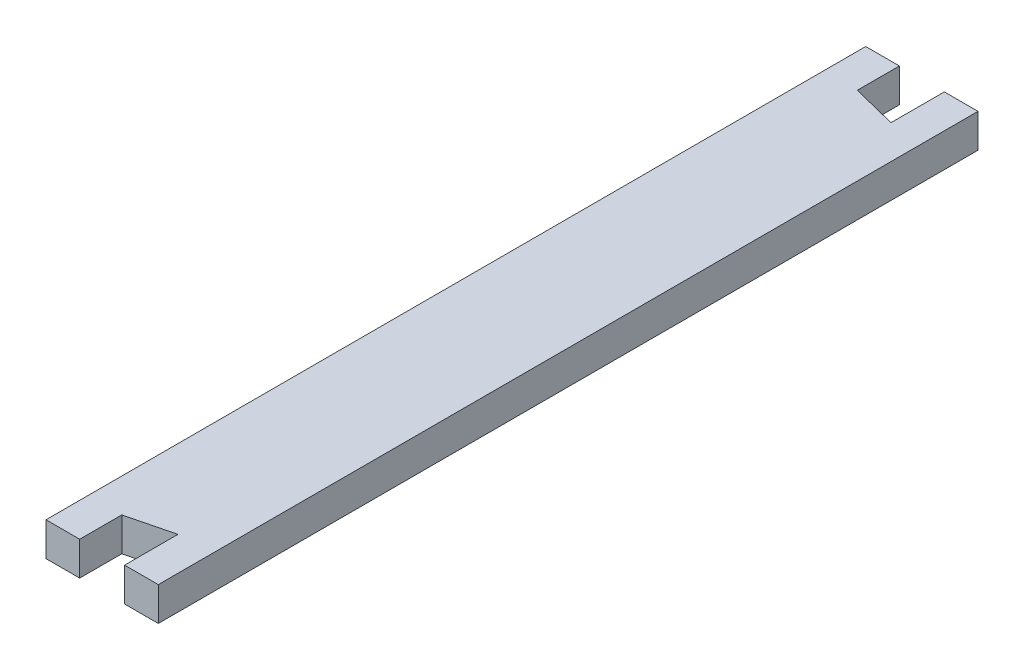
from build123d import *

# Parameters (mm, degrees)
BOSS_EXTRUDE1_DEPTH             = 15
BOSS_EXTRUDE2_REACH             = 1239.023
BOSS_EXTRUDE2_DIRECTION_2_REACH = 1239.023
CUT_EXTRUDE2_DEPTH              = 1238.578280352
CUT_EXTRUDE2_DEPTH_BACK         = 1238.578280352
SKETCH5_W                       = 40
SKETCH5_H                       = 40
CUT_EXTRUDE3_DEPTH              = 1238.578280352
BOSS_EXTRUDE4_DEPTH             = 75
CUT_EXTRUDE4_DEPTH              = 1241.107934819
CUT_EXTRUDE4_DEPTH_BACK         = 1241.107934819
SKETCH8_W                       = 15
SKETCH8_H                       = 73.7
FILLET1_R                       = 5
CUT_EXTRUDE5_DEPTH              = 1241.107934819
CUT_EXTRUDE5_DEPTH_BACK         = 1241.107934819
SKETCH9_W                       = 25
SKETCH9_H                       = 15
SKETCH9_W_2                     = 15
CUT_EXTRUDE6_DEPTH              = 1241.107934819
CUT_EXTRUDE6_DEPTH_BACK         = 1241.107934819
SKETCH10_W                      = 1728.920732784
SKETCH10_H                      = 178.853868908
SKETCH10_W_2                    = 1650
SKETCH10_H_2                    = 15
SKETCH11_W                      = 1852.680615207
SKETCH11_H                      = 1075.927112831
CUT_EXTRUDE7_DEPTH              = 1238.022635201


with BuildPart() as part:
    # Sketch1 → Boss-Extrude1 (new body)
    with BuildSketch(Plane(origin=(0, 0, 0), x_dir=(1, 0, 0), z_dir=(0, 1, 0))):
        Polygon((-450, 300), (-400, 300), (-200, 250), (600, 40), (1200, 40), (1200, -40), (600, -40), (-200, -250), (-400, -300), (-450, -300), align=None)
    extrude(amount=BOSS_EXTRUDE1_DEPTH)

    # Boss-Extrude2: up to this face of the body (flat: up to its plane)
    boss_extrude2_end = Plane(part.part.faces().sort_by_distance((-425, 7.5, 300))[0])
    # Sketch2 → Boss-Extrude2 (add, up to the picked face)
    with BuildSketch(Plane.XY, mode=Mode.PRIVATE) as boss_extrude2_sk1:
        with BuildLine():
            Line((-425, 0), (-450, 0))
            Line((-450, 0), (-450, -40))
            Line((-450, -40), (-440, -40))
            Line((-440, -40), (-440, -15))
            ThreePointArc((-440, -15), (-435.606601718, -4.393398282), (-425, 0))
        make_face()
    boss_extrude2_tool1 = split(extrude(boss_extrude2_sk1.sketch, amount=BOSS_EXTRUDE2_REACH, mode=Mode.PRIVATE), bisect_by=boss_extrude2_end, keep=Keep.BOTH, mode=Mode.PRIVATE)
    # Sketch2 → Boss-Extrude2 (add, up to the picked face)
    with BuildSketch(Plane.XY, mode=Mode.PRIVATE) as boss_extrude2_sk2:
        with BuildLine():
            Line((-400, 0), (-425, 0))
            ThreePointArc((-425, 0), (-414.393398282, -4.393398282), (-410, -15))
            Line((-410, -15), (-410, -40))
            Line((-410, -40), (-400, -40))
            Line((-400, -40), (-400, 0))
        make_face()
    boss_extrude2_tool2 = split(extrude(boss_extrude2_sk2.sketch, amount=BOSS_EXTRUDE2_REACH, mode=Mode.PRIVATE), bisect_by=boss_extrude2_end, keep=Keep.BOTH, mode=Mode.PRIVATE)
    add(boss_extrude2_tool1.solids().sort_by(Axis((-444.100555, -18.206662, 0), (0, 0, 1)))[0])
    add(boss_extrude2_tool2.solids().sort_by(Axis((-405.899445, -18.206662, 0), (0, 0, 1)))[0])

    # Boss-Extrude2 direction 2: up to this face of the body (flat: up to its plane)
    boss_extrude2_direction_2_end = Plane(part.part.faces().sort_by_distance((-425, 7.5, -300))[0])
    # Sketch2 → Boss-Extrude2 direction 2 (add, up to the picked face)
    with BuildSketch(Plane.XY, mode=Mode.PRIVATE) as boss_extrude2_direction_2_sk1:
        with BuildLine():
            Line((-425, 0), (-450, 0))
            Line((-450, 0), (-450, -40))
            Line((-450, -40), (-440, -40))
            Line((-440, -40), (-440, -15))
            ThreePointArc((-440, -15), (-435.606601718, -4.393398282), (-425, 0))
        make_face()
    boss_extrude2_direction_2_tool1 = split(extrude(boss_extrude2_direction_2_sk1.sketch, amount=-BOSS_EXTRUDE2_DIRECTION_2_REACH, mode=Mode.PRIVATE), bisect_by=boss_extrude2_direction_2_end, keep=Keep.BOTH, mode=Mode.PRIVATE)
    # Sketch2 → Boss-Extrude2 direction 2 (add, up to the picked face)
    with BuildSketch(Plane.XY, mode=Mode.PRIVATE) as boss_extrude2_direction_2_sk2:
        with BuildLine():
            Line((-400, 0), (-425, 0))
            ThreePointArc((-425, 0), (-414.393398282, -4.393398282), (-410, -15))
            Line((-410, -15), (-410, -40))
            Line((-410, -40), (-400, -40))
            Line((-400, -40), (-400, 0))
        make_face()
    boss_extrude2_direction_2_tool2 = split(extrude(boss_extrude2_direction_2_sk2.sketch, amount=-BOSS_EXTRUDE2_DIRECTION_2_REACH, mode=Mode.PRIVATE), bisect_by=boss_extrude2_direction_2_end, keep=Keep.BOTH, mode=Mode.PRIVATE)
    add(boss_extrude2_direction_2_tool1.solids().sort_by(Axis((-444.100555, -18.206662, 0), (0, 0, -1)))[0])
    add(boss_extrude2_direction_2_tool2.solids().sort_by(Axis((-405.899445, -18.206662, 0), (0, 0, -1)))[0])

    # Sketch4 → Cut-Extrude2 (cut, two sides: drawn at the far end of the back side and taken through both)
    with BuildSketch(Plane(origin=(0, 0, 0), x_dir=(1, 0, 0), z_dir=(0, 1, 0)).offset(-CUT_EXTRUDE2_DEPTH_BACK)):
        Polygon((-450, 230), (-400, 230), (-150, 167.5), (-150, -167.5), (-400, -230), (-450, -230), align=None)
        Polygon((-100, 155), (-100, -155), (520, 0), align=None)
    extrude(amount=CUT_EXTRUDE2_DEPTH + CUT_EXTRUDE2_DEPTH_BACK, mode=Mode.SUBTRACT)

    # Sketch5 → Cut-Extrude3 (cut, through all)
    with BuildSketch(Plane(origin=(0, 0, 0), x_dir=(0, 0, -1), z_dir=(1, 0, 0))):
        with Locations((-265, -20)):
            Rectangle(SKETCH5_W, SKETCH5_H)
        with Locations((265, -20)):
            Rectangle(SKETCH5_W, SKETCH5_H)
    extrude(amount=-CUT_EXTRUDE3_DEPTH, mode=Mode.SUBTRACT)

    # Sketch7 → Boss-Extrude4 (add)
    with BuildSketch(Plane(origin=(1200, 0, 0), x_dir=(0, 0, -1), z_dir=(1, 0, 0))):
        with BuildLine():
            Line((-87.5, 50), (-40, 15))
            Line((-40, 15), (40, 15))
            Line((40, 15), (87.5, 50))
            Line((87.5, 50), (87.5, 88.7))
            Line((87.5, 88.7), (58.5, 88.7))
            Line((58.5, 88.7), (58.5, 63.2))
            Line((58.5, 63.2), (48.5, 63.2))
            Line((48.5, 63.2), (48.5, 88.7))
            Line((48.5, 88.7), (20, 88.7))
            Line((20, 88.7), (20, 50))
            ThreePointArc((20, 50), (0, 30), (-20, 50))
            Line((-20, 50), (-20, 88.7))
            Line((-20, 88.7), (-63, 88.7))
            Line((-63, 88.7), (-63, 63.2))
            Line((-63, 63.2), (-73, 63.2))
            Line((-73, 63.2), (-73, 88.7))
            Line((-73, 88.7), (-87.5, 88.7))
            Line((-87.5, 88.7), (-87.5, 50))
        make_face()
    extrude(amount=-BOSS_EXTRUDE4_DEPTH)

    # Sketch8 → Cut-Extrude4 (cut, two sides: drawn at the far end of the back side and taken through both)
    with BuildSketch(Plane.XY.offset(-CUT_EXTRUDE4_DEPTH_BACK)):
        with Locations((1147.5, 51.85)):
            Rectangle(SKETCH8_W, SKETCH8_H)
        with Locations((1177.5, 51.85)):
            Rectangle(SKETCH8_W, SKETCH8_H)
    extrude(amount=CUT_EXTRUDE4_DEPTH + CUT_EXTRUDE4_DEPTH_BACK, mode=Mode.SUBTRACT)

    # Fillet1
    fillet1_edges = [part.edges().sort_by_distance(p)[0] for p in [
        (1192.5, 50, 87.5),
        (1162.5, 50, 87.5),
        (1132.5, 50, 87.5),
        (1192.5, 50, -87.5),
        (1162.5, 50, -87.5),
        (1132.5, 50, -87.5),
        (1192.5, 88.7, -87.5),
        (1162.5, 88.7, -87.5),
        (1132.5, 88.7, -87.5),
        (1132.5, 88.7, -58.5),
        (1162.5, 88.7, -58.5),
        (1192.5, 88.7, -58.5),
        (1192.5, 88.7, -48.5),
        (1162.5, 88.7, -48.5),
        (1132.5, 88.7, -48.5),
        (1192.5, 88.7, -20),
        (1162.5, 88.7, -20),
        (1132.5, 88.7, -20),
        (1192.5, 88.7, 63),
        (1162.5, 88.7, 63),
        (1132.5, 88.7, 63),
        (1132.5, 88.7, 87.5),
        (1162.5, 88.7, 87.5),
        (1192.5, 88.7, 87.5),
        (1192.5, 88.7, 73),
        (1162.5, 88.7, 73),
        (1132.5, 88.7, 73),
        (1192.5, 88.7, 20),
        (1162.5, 88.7, 20),
        (1132.5, 88.7, 20),
        (600, 7.5, 40),
        (600, 7.5, -40),
        (520, 7.5, 0),
        (-440, -40, -292.5),
        (-440, -40, -237.5),
        (-400, -40, -292.5),
        (-400, -40, -237.5),
        (-450, -40, -237.5),
        (-410, -40, -237.5),
        (-450, -40, -292.5),
        (-410, -40, -292.5),
        (-150, 7.5, 167.5),
        (-100, 7.5, 155),
        (-150, 7.5, -167.5),
        (-100, 7.5, -155),
        (-450, -40, 237.5),
        (-410, -40, 237.5),
        (-440, -40, 237.5),
        (-400, -40, 237.5),
        (-450, -40, 292.5),
        (-440, -40, 292.5),
        (-400, -40, 292.5),
        (-410, -40, 292.5),
    ]]
    fillet(fillet1_edges, radius=FILLET1_R - 0.0001)  # a hair under: the kernel refuses the full size

    # Sketch9 → Cut-Extrude5 (cut, two sides: drawn at the far end of the back side and taken through both)
    with BuildSketch(Plane(origin=(0, 0, 0), x_dir=(1, 0, 0), z_dir=(0, 1, 0)).offset(-CUT_EXTRUDE5_DEPTH_BACK)):
        with Locations((-425, -292.5)):
            Rectangle(SKETCH9_W, SKETCH9_H)
        with Locations((1192.5, -32.5)):
            Rectangle(SKETCH9_W_2, SKETCH9_H)
        with Locations((1192.5, 32.5)):
            Rectangle(SKETCH9_W_2, SKETCH9_H)
        with Locations((1162.5, 32.5)):
            Rectangle(SKETCH9_W_2, SKETCH9_H)
        with Locations((1132.5, 32.5)):
            Rectangle(SKETCH9_W_2, SKETCH9_H)
        with Locations((1132.5, -32.5)):
            Rectangle(SKETCH9_W_2, SKETCH9_H)
        with Locations((1162.5, -32.5)):
            Rectangle(SKETCH9_W_2, SKETCH9_H)
        with Locations((-425, -237.5)):
            Rectangle(SKETCH9_W, SKETCH9_H)
        with Locations((-425, 237.5)):
            Rectangle(SKETCH9_W, SKETCH9_H)
        with Locations((-425, 292.5)):
            Rectangle(SKETCH9_W, SKETCH9_H)
    extrude(amount=CUT_EXTRUDE5_DEPTH + CUT_EXTRUDE5_DEPTH_BACK, mode=Mode.SUBTRACT)


with BuildPart() as cut_extrude5_piece_1:
    # of the separate pieces the step leaves, piece 1, a body of its own (cut_extrude5_pieces)
    add(part.part.solids().sort_by_distance((-400, -35.0001, -300))[0])


with BuildPart() as cut_extrude5_piece_2:
    # of the separate pieces the step leaves, piece 2, a body of its own (cut_extrude5_pieces)
    add(part.part.solids().sort_by_distance((1170, 48.501289589, 85.46603587))[0])


with BuildPart() as cut_extrude5_piece_3:
    # of the separate pieces the step leaves, piece 3, a body of its own (cut_extrude5_pieces)
    add(part.part.solids().sort_by_distance((1170, 48.501289589, -85.46603587))[0])


with BuildPart() as cut_extrude5_piece_4:
    # of the separate pieces the step leaves, piece 4, a body of its own (cut_extrude5_pieces)
    add(part.part.solids().sort_by_distance((1125, 83.7001, 73))[0])


with BuildPart() as cut_extrude5_piece_5:
    # of the separate pieces the step leaves, piece 5, a body of its own (cut_extrude5_pieces)
    add(part.part.solids().sort_by_distance((1200, 48.501289589, 85.46603587))[0])


with BuildPart() as cut_extrude5_piece_6:
    # of the separate pieces the step leaves, piece 6, a body of its own (cut_extrude5_pieces)
    add(part.part.solids().sort_by_distance((1200, 48.501289589, -85.46603587))[0])


with BuildPart() as cut_extrude5_piece_7:
    # of the separate pieces the step leaves, piece 7, a body of its own (cut_extrude5_pieces)
    add(part.part.solids().sort_by_distance((1125, 88.7, -40))[0])


with BuildPart() as cut_extrude6_tool:
    # Sketch10 → Cut-Extrude6 (new, two sides: drawn at the far end of the back side and taken through both)
    with BuildSketch(Plane.XY.offset(-CUT_EXTRUDE6_DEPTH_BACK)):
        with Locations((378.379601058, 20.599691165)):
            Rectangle(SKETCH10_W, SKETCH10_H)
        with Locations((375, 7.5)):
            Rectangle(SKETCH10_W_2, SKETCH10_H_2, mode=Mode.SUBTRACT)
    extrude(amount=CUT_EXTRUDE6_DEPTH + CUT_EXTRUDE6_DEPTH_BACK)


with BuildPart() as cut_extrude5_piece_1_1:
    add(cut_extrude5_piece_1.part)

    # Cut-Extrude6: cut by cut_extrude6_tool
    add(cut_extrude6_tool.part, mode=Mode.SUBTRACT)

    # Sketch11 → Cut-Extrude7 (cut, through all)
    # profile 1 of 5: a face of its own
    with BuildSketch(Plane(origin=(0, 0, 0), x_dir=(1, 0, 0), z_dir=(0, 1, 0))):
        with Locations((324.970767393, -26.108881651)):
            Rectangle(SKETCH11_W, SKETCH11_H)
        Polygon((309.276307823, -116.314969197), (-450, -315.625), (-450, -242.5), (-450, -230), (-400, -230), (-150, -167.5), (-150, 0), (-150, 167.5), (-150, 182.5), (-135, 182.5), (-135, 163.75), (-115, 158.75), (-115, 182.5), (-100, 182.5), (-100, 155), (-100, 0), (-100, -155), (293.601058917, -56.599735271), (308.154197556, -52.961450611), (311.917995324, -67.299727825), (319.976300377, -97.99803279), (323.784772304, -112.50649727), align=None, mode=Mode.SUBTRACT)
    # profile 2 of 5: a face of its own
    with BuildSketch(Plane(origin=(0, 0, 0), x_dir=(1, 0, 0), z_dir=(0, 1, 0))):
        Polygon((-450, -242.5), (-450, -315.625), (309.276307823, -116.314969197), (305.467835897, -101.806504716), (319.976300377, -97.99803279), (311.917995324, -67.299727825), (297.409530844, -71.108199751), (293.601058917, -56.599735271), (-100, -155), (-100, -182.5), (-115, -182.5), (-115, -158.75), (-135, -163.75), (-135, -182.5), (-150, -182.5), (-150, -167.5), (-400, -230), align=None)
    # profile 3 of 5: a face of its own
    with BuildSketch(Plane(origin=(0, 0, 0), x_dir=(1, 0, 0), z_dir=(0, 1, 0))):
        Polygon((-450, -230), (-450, -242.5), (-400, -230), align=None)
    # profile 4 of 5: a face of its own
    with BuildSketch(Plane(origin=(0, 0, 0), x_dir=(1, 0, 0), z_dir=(0, 1, 0))):
        Polygon((305.467835897, -101.806504716), (309.276307823, -116.314969197), (323.784772304, -112.50649727), (319.976300377, -97.99803279), align=None)
    # profile 5 of 5: a face of its own
    with BuildSketch(Plane(origin=(0, 0, 0), x_dir=(1, 0, 0), z_dir=(0, 1, 0))):
        Polygon((297.409530844, -71.108199751), (311.917995324, -67.299727825), (308.154197556, -52.961450611), (293.601058917, -56.599735271), align=None)
    extrude(amount=CUT_EXTRUDE7_DEPTH, mode=Mode.SUBTRACT)


with BuildPart() as cut_extrude5_piece_2_1:
    add(cut_extrude5_piece_2.part)

    # Cut-Extrude6: cut by cut_extrude6_tool
    add(cut_extrude6_tool.part, mode=Mode.SUBTRACT)


with BuildPart() as cut_extrude5_piece_3_1:
    add(cut_extrude5_piece_3.part)

    # Cut-Extrude6: cut by cut_extrude6_tool
    add(cut_extrude6_tool.part, mode=Mode.SUBTRACT)


with BuildPart() as cut_extrude5_piece_4_1:
    add(cut_extrude5_piece_4.part)

    # Cut-Extrude6: cut by cut_extrude6_tool
    add(cut_extrude6_tool.part, mode=Mode.SUBTRACT)


with BuildPart() as cut_extrude5_piece_5_1:
    add(cut_extrude5_piece_5.part)

    # Cut-Extrude6: cut by cut_extrude6_tool
    add(cut_extrude6_tool.part, mode=Mode.SUBTRACT)


with BuildPart() as cut_extrude5_piece_6_1:
    add(cut_extrude5_piece_6.part)

    # Cut-Extrude6: cut by cut_extrude6_tool
    add(cut_extrude6_tool.part, mode=Mode.SUBTRACT)


with BuildPart() as cut_extrude5_piece_7_1:
    add(cut_extrude5_piece_7.part)

    # Cut-Extrude6: cut by cut_extrude6_tool
    add(cut_extrude6_tool.part, mode=Mode.SUBTRACT)


solid = cut_extrude5_piece_1_1.part
